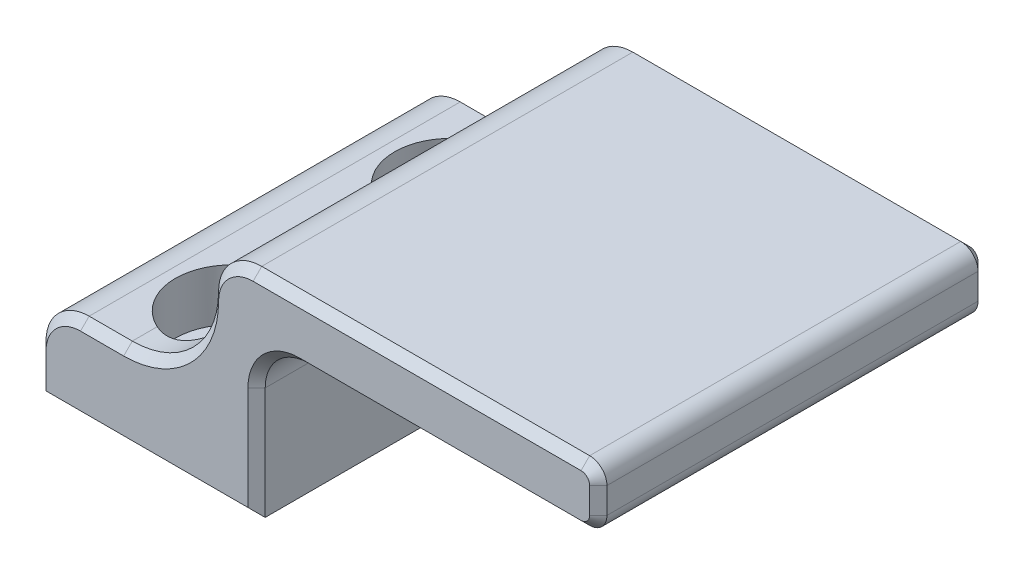
from build123d import *

# Parameters (mm, degrees)
BOSS_EXTRUDE1_DEPTH = 22.5
SKETCH3_R           = 4
CUT_EXTRUDE1_DEPTH  = 51.204979833
SKETCH3_4_R         = 6.5
SKETCH3_4_R_2       = 4
CUT_EXTRUDE2_DEPTH  = 6
FILLET1_R           = 10
FILLET2_R           = 5
FILLET4_R           = 2
CHAMFER1_SIZE       = 1


# Some blends are built 0.0001 mm under size
with BuildPart() as part:
    # Sketch1 → Boss-Extrude1 (new, symmetric)
    with BuildSketch(Plane.XY):
        Polygon((-22.7, -12.5), (2.7, -12.5), (2.7, 5.5), (42.3, 5.5), (42.3, 12.5), (-2.7, 12.5), (-2.7, -2.5), (-22.7, -2.5), align=None)
    extrude(amount=BOSS_EXTRUDE1_DEPTH, both=True)

    # Sketch3 → Cut-Extrude1 (cut, through all)
    with BuildSketch(Plane(origin=(0, -2.5, 0), x_dir=(1, 0, 0), z_dir=(0, 1, 0))):
        with Locations(Location((-10, -12.7, 0), (0, 0, 180))):
            Circle(SKETCH3_R)
    cut_extrude1 = extrude(amount=-CUT_EXTRUDE1_DEPTH, mode=Mode.SUBTRACT)

    # Sketch3<4> → Cut-Extrude2 (cut)
    with BuildSketch(Plane(origin=(0, -2.5, 0), x_dir=(1, 0, 0), z_dir=(0, 1, 0))):
        with Locations(Location((-10, -12.7, 0), (0, 0, 180))):
            Circle(SKETCH3_4_R)
        with Locations(Location((-10, -12.7, 0), (0, 0, 180))):
            Circle(SKETCH3_4_R_2, mode=Mode.SUBTRACT)
    cut_extrude2 = extrude(amount=-CUT_EXTRUDE2_DEPTH, mode=Mode.SUBTRACT)

    # Mirror1: Cut-Extrude1, Cut-Extrude2 across plane
    add(cut_extrude1.mirror(Plane.XY), mode=Mode.SUBTRACT)
    add(cut_extrude2.mirror(Plane.XY), mode=Mode.SUBTRACT)

    # Fillet1
    # the kernel refuses this fillet: 10 mm, written as the material it adds along each edge
    with BuildSketch(Plane(origin=(-2.7, -2.5, 22.5), x_dir=(0, 1, 0), z_dir=(0, 0, -1))) as fillet1_piece_1_section:
        with BuildLine():
            CenterArc((FILLET1_R, -FILLET1_R), FILLET1_R, 90, 90)
            Line((0, -FILLET1_R), (0, 0))
            Line((0, 0), (FILLET1_R, 0))
        make_face()
    fillet1_piece_1 = extrude(amount=45, mode=Mode.PRIVATE)
    fillet1_piece_1 = fillet1_piece_1 - Plane(origin=(-10, 0.155378063, -12.7), x_dir=(-1, 0, 0), z_dir=(0, 1, 0)) * Cylinder(6.5, 130, mode=Mode.PRIVATE)
    fillet1_piece_1 = fillet1_piece_1 - Plane(origin=(-10, 0.155378063, 12.7), x_dir=(-1, 0, 0), z_dir=(0, 1, 0)) * Cylinder(6.5, 130, mode=Mode.PRIVATE)
    add(fillet1_piece_1)

    # Fillet2
    fillet2_edges = [part.edges().sort_by_distance(p)[0] for p in [
        (2.7, 5.5, 0),
        (-22.7, -2.5, 0),
        (-2.7, 12.5, 0),
    ]]
    fillet(fillet2_edges, radius=FILLET2_R - 0.0001)  # a hair under: the kernel refuses the full size

    # Fillet4
    fillet4_edges = [part.edges().sort_by_distance(p)[0] for p in [
        (42.3, 12.5, 0),
        (42.3, 5.5, 0),
    ]]
    fillet(fillet4_edges, radius=FILLET4_R)

    # Chamfer1
    chamfer1_edges = [part.edges().sort_by_distance(p)[0] for p in [
        (2.7, -5.99995, -22.5),
        (-10, -12.5, -22.5),
        (2.7, -5.99995, 22.5),
        (-15.20005, -2.5, -22.5),
        (-15.20005, -2.5, 22.5),
        (-5.628932188, 0.428932188, -22.5),
        (-5.628932188, 0.428932188, 22.5),
        (-22.7, -9.99995, -22.5),
        (-22.7, -9.99995, 22.5),
        (23.99995, 5.5, -22.5),
        (-1.235563195, 11.035563195, -22.5),
        (-21.235563195, -3.964436805, -22.5),
        (23.99995, 5.5, 22.5),
        (-1.235563195, 11.035563195, 22.5),
        (-21.235563195, -3.964436805, 22.5),
        (4.164436805, 4.035563195, -22.5),
        (4.164436805, 4.035563195, 22.5),
        (21.29995, 12.5, -22.5),
        (21.29995, 12.5, 22.5),
        (42.3, 9, -22.5),
        (41.714213562, 6.085786438, -22.5),
        (41.714213562, 11.914213562, -22.5),
        (42.3, 9, 22.5),
        (41.714213562, 6.085786438, 22.5),
        (41.714213562, 11.914213562, 22.5),
        (-10, -12.5, 22.5),
    ]]
    chamfer(chamfer1_edges, length=CHAMFER1_SIZE)


solid = part.part
